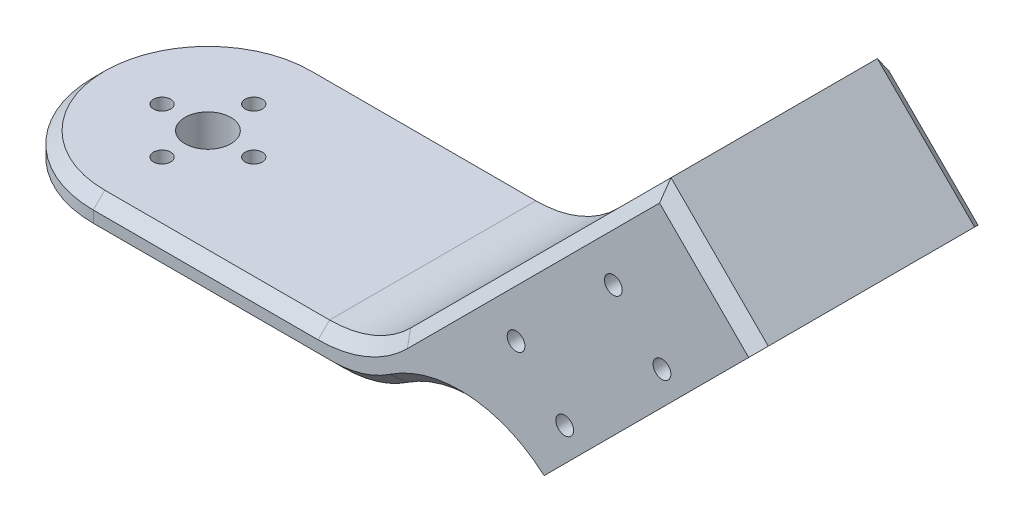
from build123d import *

# Parameters (mm, degrees)
BOSS_EXTRUDE1_DEPTH     = 40
SKETCH2_W               = 40
SKETCH2_H               = 54.5
SKETCH2_W_2             = 1.5
SKETCH2_H_2             = 46.5
BOSS_EXTRUDE2_DEPTH     = 18
SKETCH3_W               = 29
SKETCH3_H               = 46.5
CUT_EXTRUDE1_DEPTH      = 30
SKETCH4_R               = 4
SKETCH4_R_2             = 1.5
CUT_EXTRUDE2_DEPTH      = 30
CUT_EXTRUDE3_DEPTH      = 153.681139277
CUT_EXTRUDE3_DEPTH_BACK = 153.681139277
SKETCH8_R               = 1.55
SKETCH8_R_2             = 1.05
FILLET1_R               = 20
FILLET2_R               = 20
FILLET3_R               = 20
CHAMFER1_SIZE           = 2


# Some blends are built 0.0001 mm under size
with BuildPart() as part:
    # Sketch1 → Boss-Extrude1 (new body)
    with BuildSketch(Plane.XY):
        Polygon((118.790367902, 57.275649276), (67.514718626, 6), (0, 6), (0, 0), (70, 0), (123.033008589, 53.033008589), align=None)
    extrude(amount=BOSS_EXTRUDE1_DEPTH)

    # Sketch2 → Boss-Extrude2 (add)
    # profile 1 of 3: a face of its own
    with BuildSketch(Plane(origin=(35, -35, 0), x_dir=(0, 0, -1), z_dir=(0.7071067811865521, -0.707106781186543, 0))):
        with Locations((-20, 97.247474683)):
            Rectangle(SKETCH2_W, SKETCH2_H)
        Polygon((-36, 73.997474683), (-36, 120.497474683), (-34.5, 120.497474683), (-5.5, 120.497474683), (-4, 120.497474683), (-4, 73.997474683), (-5.5, 73.997474683), (-34.5, 73.997474683), align=None, mode=Mode.SUBTRACT)
    # profile 2 of 3: a face of its own
    with BuildSketch(Plane(origin=(35, -35, 0), x_dir=(0, 0, -1), z_dir=(0.7071067811865521, -0.707106781186543, 0))):
        with Locations((-35.25, 97.247474683)):
            Rectangle(SKETCH2_W_2, SKETCH2_H_2)
    # profile 3 of 3: a face of its own
    with BuildSketch(Plane(origin=(35, -35, 0), x_dir=(0, 0, -1), z_dir=(0.7071067811865521, -0.707106781186543, 0))):
        with Locations((-4.75, 97.247474683)):
            Rectangle(SKETCH2_W_2, SKETCH2_H_2)
    extrude(amount=BOSS_EXTRUDE2_DEPTH)

    # Sketch3 → Cut-Extrude1 (cut)
    with BuildSketch(Plane(origin=(35, -35, 0), x_dir=(0, 0, -1), z_dir=(0.7071067811865521, -0.707106781186543, 0))):
        with Locations((-20, 97.247474683)):
            Rectangle(SKETCH3_W, SKETCH3_H)
    extrude(amount=-CUT_EXTRUDE1_DEPTH, mode=Mode.SUBTRACT)

    # Sketch4 → Cut-Extrude2 (cut)
    with BuildSketch(Plane(origin=(0, 6, 0), x_dir=(1, 0, 0), z_dir=(0, 1, 0))):
        with Locations(Location((20, -20, 0), (0, 0, 270))):
            Circle(SKETCH4_R)
        with Locations(Location((20, -12, 0), (0, 0, 270))):
            Circle(SKETCH4_R_2)
        with Locations(Location((28, -20, 0), (0, 0, 270))):
            Circle(SKETCH4_R_2)
        with Locations(Location((20, -28, 0), (0, 0, 270))):
            Circle(SKETCH4_R_2)
        with Locations(Location((12, -20, 0), (0, 0, 270))):
            Circle(SKETCH4_R_2)
    extrude(amount=-CUT_EXTRUDE2_DEPTH, mode=Mode.SUBTRACT)

    # Sketch8 → Cut-Extrude3 (cut, two sides: drawn at the far end of the back side and taken through both)
    # profile 1 of 8: a face of its own
    with BuildSketch(Plane.XY.offset(40).offset(-CUT_EXTRUDE3_DEPTH_BACK)):
        with Locations((93.758787848, 21.071782079)):
            Circle(SKETCH8_R)
        with Locations((93.758787848, 21.071782079)):
            Circle(SKETCH8_R_2, mode=Mode.SUBTRACT)
    # profile 2 of 8: a face of its own
    with BuildSketch(Plane.XY.offset(40).offset(-CUT_EXTRUDE3_DEPTH_BACK)):
        with Locations((93.758787848, 21.071782079)):
            Circle(SKETCH8_R_2)
    # profile 3 of 8: a face of its own
    with BuildSketch(Plane.XY.offset(40).offset(-CUT_EXTRUDE3_DEPTH_BACK)):
        with Locations((102.244069222, 12.586500705)):
            Circle(SKETCH8_R)
        with Locations((102.244069222, 12.586500705)):
            Circle(SKETCH8_R_2, mode=Mode.SUBTRACT)
    # profile 4 of 8: a face of its own
    with BuildSketch(Plane.XY.offset(40).offset(-CUT_EXTRUDE3_DEPTH_BACK)):
        with Locations((102.244069222, 12.586500705)):
            Circle(SKETCH8_R_2)
    # profile 5 of 8: a face of its own
    with BuildSketch(Plane.XY.offset(40).offset(-CUT_EXTRUDE3_DEPTH_BACK)):
        with Locations((110.729350596, 38.042344828)):
            Circle(SKETCH8_R)
        with Locations((110.729350596, 38.042344828)):
            Circle(SKETCH8_R_2, mode=Mode.SUBTRACT)
    # profile 6 of 8: a face of its own
    with BuildSketch(Plane.XY.offset(40).offset(-CUT_EXTRUDE3_DEPTH_BACK)):
        with Locations((110.729350596, 38.042344828)):
            Circle(SKETCH8_R_2)
    # profile 7 of 8: a face of its own
    with BuildSketch(Plane.XY.offset(40).offset(-CUT_EXTRUDE3_DEPTH_BACK)):
        with Locations((119.214631971, 29.557063454)):
            Circle(SKETCH8_R)
        with Locations((119.214631971, 29.557063454)):
            Circle(SKETCH8_R_2, mode=Mode.SUBTRACT)
    # profile 8 of 8: a face of its own
    with BuildSketch(Plane.XY.offset(40).offset(-CUT_EXTRUDE3_DEPTH_BACK)):
        with Locations((119.214631971, 29.557063454)):
            Circle(SKETCH8_R_2)
    extrude(amount=CUT_EXTRUDE3_DEPTH + CUT_EXTRUDE3_DEPTH_BACK, mode=Mode.SUBTRACT)

    # Fillet1
    fillet1_edges = [part.edges().sort_by_distance(p)[0] for p in [
        (67.514718626, 6, 20),
        (70, 0, 20),
    ]]
    fillet(fillet1_edges, radius=FILLET1_R)

    # Fillet2
    # the kernel refuses this fillet: 20 mm, written as the material it adds along each edge
    with BuildSketch(Plane(origin=(84.495689014, 14.495689014, 40), x_dir=(0.7071067811865529, -0.7071067811865424, 0), z_dir=(0, 0, -1))) as fillet2_piece_1:
        with BuildLine():
            CenterArc((19.242903422, 19.961342417), FILLET2_R, 191.165307073, 75.271741026)
            Line((-0.378548289, 16.088535585), (-2.34069346, 15.701254901))
            ThreePointArc((-2.34069346, 15.701254901), (-2, 12.215728753), (-2, 0))
            Line((-2, 0), (0, -2))
            ThreePointArc((0, -2), (9, -2), (17.875709658, -1.996134242))
            Line((17.875709658, -1.996134242), (18, 0))
        make_face()
    extrude(amount=40)

    # Fillet3
    fillet3_edges = [part.edges().sort_by_distance(p)[0] for p in [
        (0, 3, 0),
        (0, 3, 40),
    ]]
    fillet(fillet3_edges, radius=FILLET3_R - 0.0001)  # a hair under: the kernel refuses the full size

    # Chamfer1
    chamfer1_edges = [part.edges().sort_by_distance(p)[0] for p in [
        (96.081475452, 34.566756826, 0),
        (96.081475452, 34.566756826, 40),
        (67.53556592, 0.865489414, 40),
        (66.884116026, 7.52240935, 0),
        (66.884116026, 7.52240935, 40),
        (67.53556592, 0.865489414, 0),
        (85.313564088, 6.73010305, 0),
        (127.275649276, 48.790367902, 40),
        (85.313564088, 6.73010305, 40),
        (40.857814376, 0, 0),
        (39.615173689, 6, 0),
        (39.615173689, 6, 40),
        (5.857835087, 6, 34.142164913),
        (5.857835087, 6, 5.857835087),
        (40.857814376, 0, 40),
        (5.857835087, 0, 34.142164913),
        (5.857835087, 0, 5.857835087),
        (127.275649276, 48.790367902, 0),
    ]]
    chamfer(chamfer1_edges, length=CHAMFER1_SIZE)


solid = part.part
